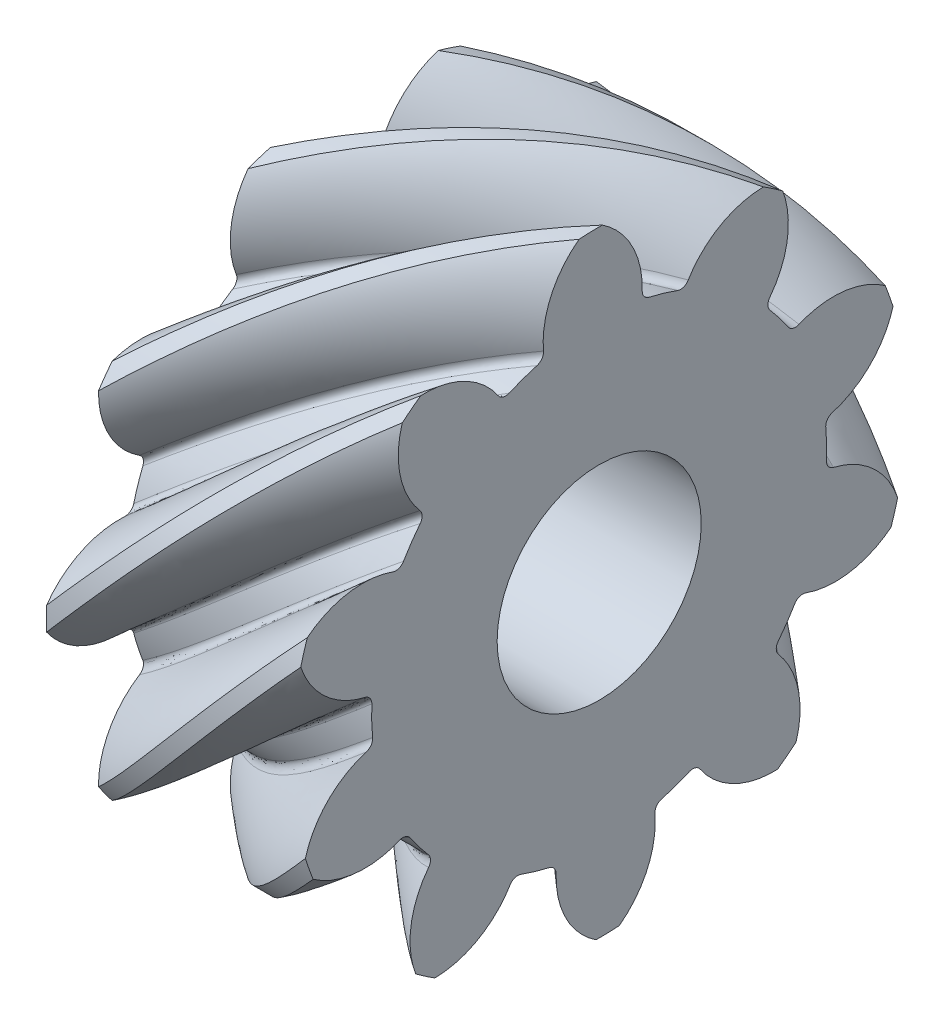
from build123d import *

# Parameters (mm, degrees)
BASPROSKE_W            = 12
BASPROSKE_H            = 15.087214509
TOOTHCUTLH_PITCH       = 82.404700905
TOOTHCUTLH_HEIGHT      = 12
TOOTHCUTLH_RADIUS      = 15.087214509
TOOTHCUTLH_START_ANGLE = -90
TEETHCUTSLH_COUNT      = 10
TEETHCUTSLH_ANGLE      = 324
BORSKE_R               = 5
BORE_DEPTH             = 62.5000025


with BuildPart() as part:
    # BasProSke → Base-Revolve (revolve)
    with BuildSketch(Plane(origin=(0, 0, 0), x_dir=(1, 0, 0), z_dir=(0, 1, 0)), mode=Mode.PRIVATE) as base_revolve_sk:
        with Locations((6, 7.543607255)):
            Rectangle(BASPROSKE_W, BASPROSKE_H)
    revolve(base_revolve_sk.sketch.rotate(Axis((-10, 0, 0), (1, 0, 0)), 180), axis=Axis((-10, 0, 0), (1, 0, 0)))

    # ToothCutLH: sweep along a helix
    with BuildLine() as toothcutlh_path:
        add(Helix(TOOTHCUTLH_PITCH, TOOTHCUTLH_HEIGHT, TOOTHCUTLH_RADIUS, center=(0, 0, 0), direction=(1, 0, 0), lefthand=True, mode=Mode.PRIVATE).rotate(Axis((0, 0, 0), (1, 0, 0)), TOOTHCUTLH_START_ANGLE))
    # TooCutSkeRH<3> → ToothCutLH (sweep, cut)
    with BuildSketch(Plane(origin=(0, 0, 0), x_dir=(0, 0, -1), z_dir=(1, 0, 0))):
        with BuildLine():
            ThreePointArc((0.723345615, 11.126225988), (0, 11.149714509), (-0.723345615, 11.126225988))
            ThreePointArc((-0.723345615, 11.126225988), (-1.007927273, 11.207883977), (-1.175746561, 11.451792636))
            ThreePointArc((-1.175746561, 11.451792636), (-2.598890934, 13.690285338), (-5.053798461, 14.695083085))
            ThreePointArc((-5.053798461, 14.695083085), (0, 15.539830944), (5.053798461, 14.695083085))
            ThreePointArc((5.053798461, 14.695083085), (2.598890934, 13.690285338), (1.175746561, 11.451792636))
            ThreePointArc((1.175746561, 11.451792636), (1.007927273, 11.207883977), (0.723345615, 11.126225988))
        make_face()
    toothcutlh = sweep(path=toothcutlh_path.line, is_frenet=True, mode=Mode.SUBTRACT)

    # TeethCutsLH: ToothCutLH ×10 about axis
    teethcutslh_axis = Axis((-10, 0, 0), (1, 0, 0))
    for i in range(1, TEETHCUTSLH_COUNT):
        add(toothcutlh.rotate(teethcutslh_axis, i * TEETHCUTSLH_ANGLE / (TEETHCUTSLH_COUNT - 1)), mode=Mode.SUBTRACT)

    # BorSke → Bore (cut, symmetric)
    with BuildSketch(Plane(origin=(0, 0, 0), x_dir=(0, 0, -1), z_dir=(1, 0, 0))):
        with Locations(Location((0, 0, 0), (0, 0, 180))):
            Circle(BORSKE_R)
    extrude(amount=BORE_DEPTH, both=True, mode=Mode.SUBTRACT)


solid = part.part
